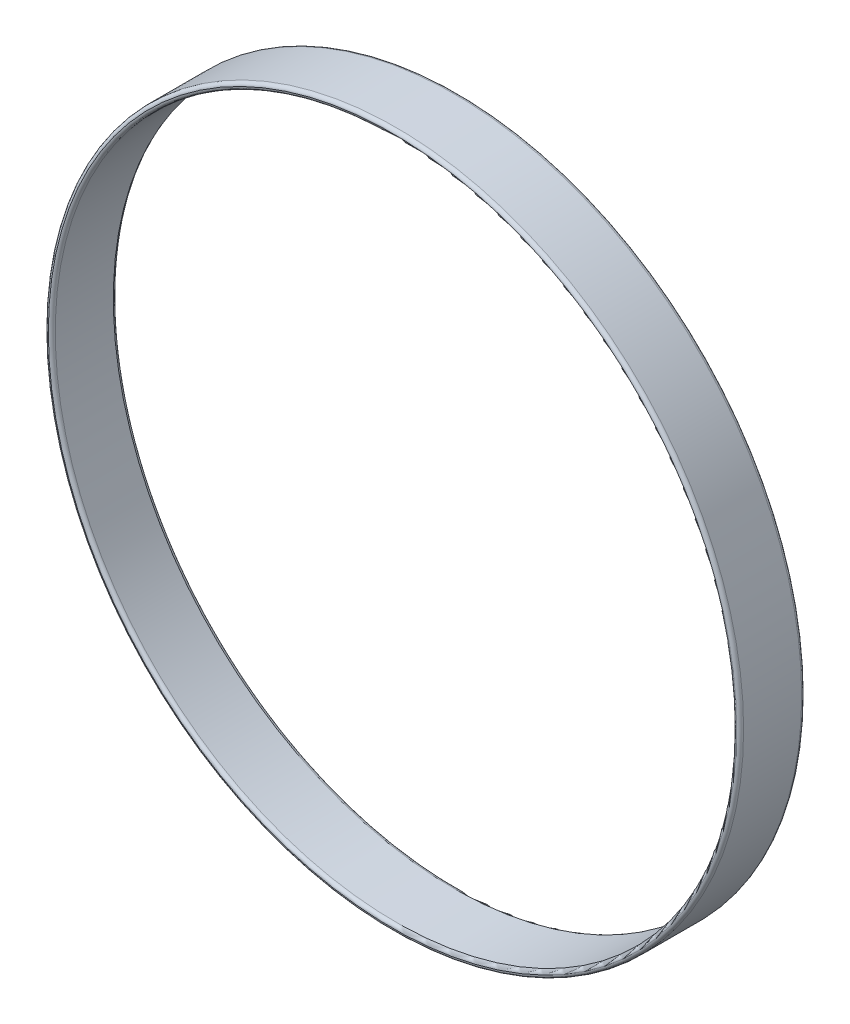
from build123d import *

# Parameters (mm, degrees)
ESQUISSE1_R        = 50
BOSS_EXTRU_1_DEPTH = 9.35
COQUE1_T           = -1
CONG_1_R           = 0.5


with BuildPart() as part:
    # Esquisse1 → Boss.-Extru.1 (new body)
    with BuildSketch(Plane.XY):
        Circle(ESQUISSE1_R)
    extrude(amount=BOSS_EXTRU_1_DEPTH)

    # Coque1
    coque1_openings = [part.faces().sort_by_distance(p)[0] for p in [
        (0, 0, 9.35),
        (0, 0, 0),
    ]]
    offset(amount=COQUE1_T, openings=coque1_openings, kind=Kind.INTERSECTION)

    # Congé1
    cong_1_edges = [part.edges().sort_by_distance(p)[0] for p in [
        (-50, 0, 0),
        (-50, 0, 9.35),
        (-49, 0, 0),
        (-49, 0, 9.35),
    ]]
    fillet(cong_1_edges, radius=CONG_1_R - 0.0001)  # a hair under: the kernel refuses the full size


solid = part.part
